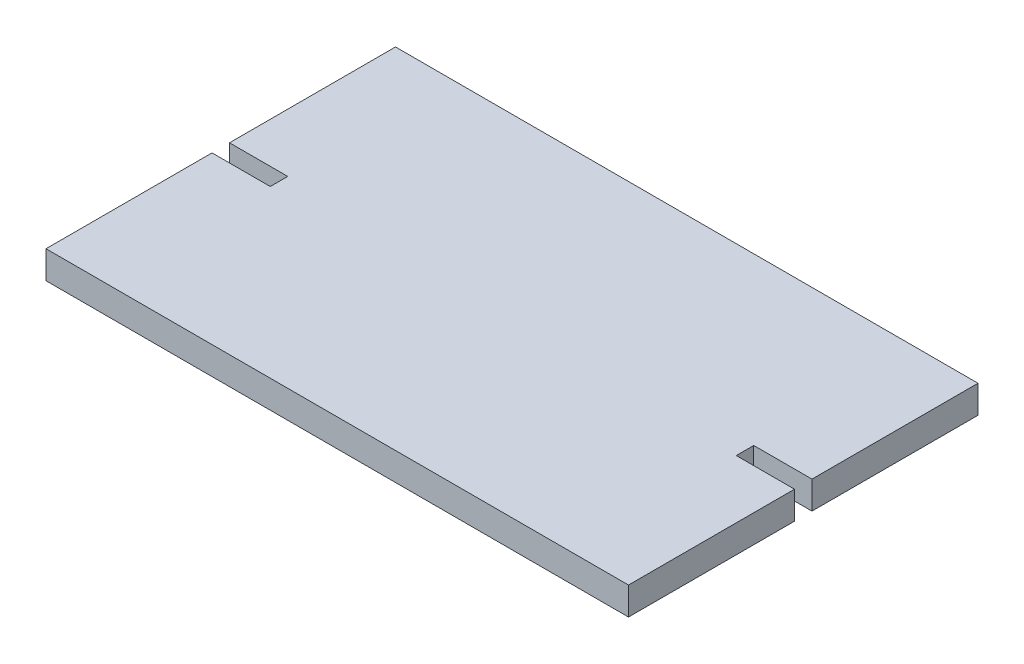
from build123d import *

# Parameters (mm, degrees)
BOSS_EXTRUDE1_DEPTH = 4.7625


with BuildPart() as part:
    # Sketch3 → Boss-Extrude1 (new body)
    with BuildSketch(Plane(origin=(0, 0, 0), x_dir=(1, 0, 0), z_dir=(0, 1, 0))):
        Polygon((-50, -30), (50, -30), (50, -1.5), (40, -1.5), (40, 1.5), (50, 1.5), (50, 30), (-50, 30), (-50, 1.5), (-40, 1.5), (-40, -1.5), (-50, -1.5), align=None)
    extrude(amount=BOSS_EXTRUDE1_DEPTH)


solid = part.part
